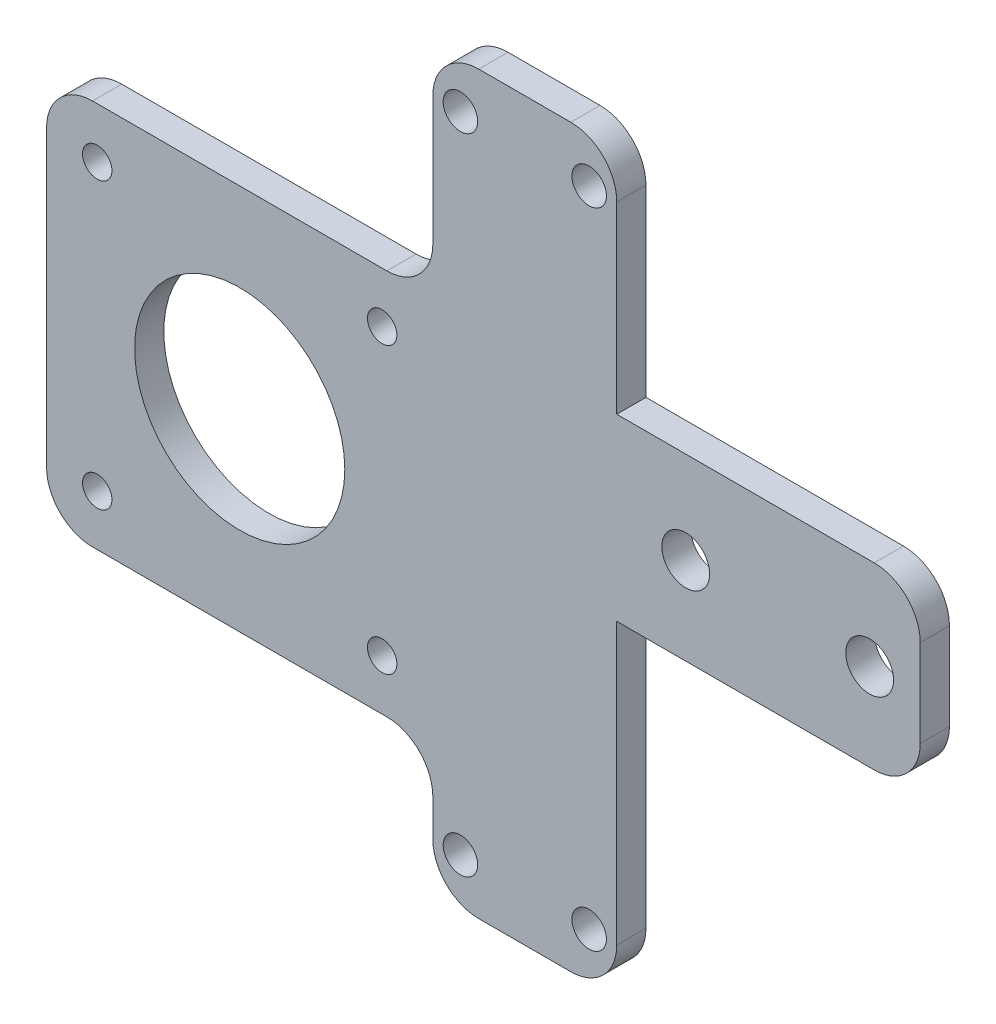
from build123d import *

# Parameters (mm, degrees)
BASE_FLANGE1_DEPTH         = 3.175
M3_5_CLEARANCE_HOLE1_D     = 3.75
F_5_2_5_2_DIAMETER_HOLE1_D = 5.2
F_3_2_3_2_DIAMETER_HOLE1_D = 3.2
M20_CLEARANCE_HOLE1_D      = 22.86


# Sheet-metal steps are written as plain solids
with BuildPart() as part:
    # Sketch11 → Base-Flange1 (new body)
    with BuildSketch(Plane.XY.offset(3.175)):
        with BuildLine():
            Line((-42, 51), (-42, 19))
            ThreePointArc((-42, 19), (-40.535533906, 15.464466094), (-37, 14))
            Line((-37, 14), (-5, 14))
            ThreePointArc((-5, 14), (-1.464466094, 12.535533906), (0, 9))
            Line((0, 9), (0, 5))
            ThreePointArc((0, 5), (1.464466094, 1.464466094), (5, 0))
            Line((5, 0), (15, 0))
            ThreePointArc((15, 0), (18.535533906, 1.464466094), (20, 5))
            Line((20, 5), (20, 35.499999523))
            Line((20, 35.499999523), (48, 35.499999523))
            ThreePointArc((48, 35.499999523), (51.535533906, 36.964465617), (53, 40.499999523))
            Line((53, 40.499999523), (53, 50))
            ThreePointArc((53, 50), (51.535533906, 53.535533906), (48, 55))
            Line((48, 55), (20, 55))
            Line((20, 55), (20, 75))
            ThreePointArc((20, 75), (18.535533906, 78.535533906), (15, 80))
            Line((15, 80), (5, 80))
            ThreePointArc((5, 80), (1.464466094, 78.535533906), (0, 75))
            Line((0, 75), (0, 61))
            ThreePointArc((0, 61), (-1.464466094, 57.464466094), (-5, 56))
            Line((-5, 56), (-37, 56))
            ThreePointArc((-37, 56), (-40.535533906, 54.535533906), (-42, 51))
        make_face()
    extrude(amount=-BASE_FLANGE1_DEPTH)

    # M3.5 Clearance Hole1 (through all)
    with Locations(Plane.XY.offset(3.175)):
        with Locations((17, 75), (3, 5), (3, 75), (17, 5)):
            Hole(M3_5_CLEARANCE_HOLE1_D / 2)

    # Ø5.2 (5.2) Diameter Hole1 (through all)
    with Locations(Plane.XY.offset(3.175)):
        with Locations((47.5, 45), (27.5, 45)):
            Hole(F_5_2_5_2_DIAMETER_HOLE1_D / 2)

    # Ø3.2 (3.2) Diameter Hole1 (through all)
    with Locations(Plane.XY.offset(3.175)):
        with Locations((-36.490941809, 50.490941809), (-5.509058191, 50.490941809), (-5.509058191, 19.509058191), (-36.490941809, 19.509058191)):
            Hole(F_3_2_3_2_DIAMETER_HOLE1_D / 2)

    # M20 Clearance Hole1 (through all)
    with Locations(Plane.XY.offset(3.175)):
        with Locations((-21, 35)):
            Hole(M20_CLEARANCE_HOLE1_D / 2)


solid = part.part
